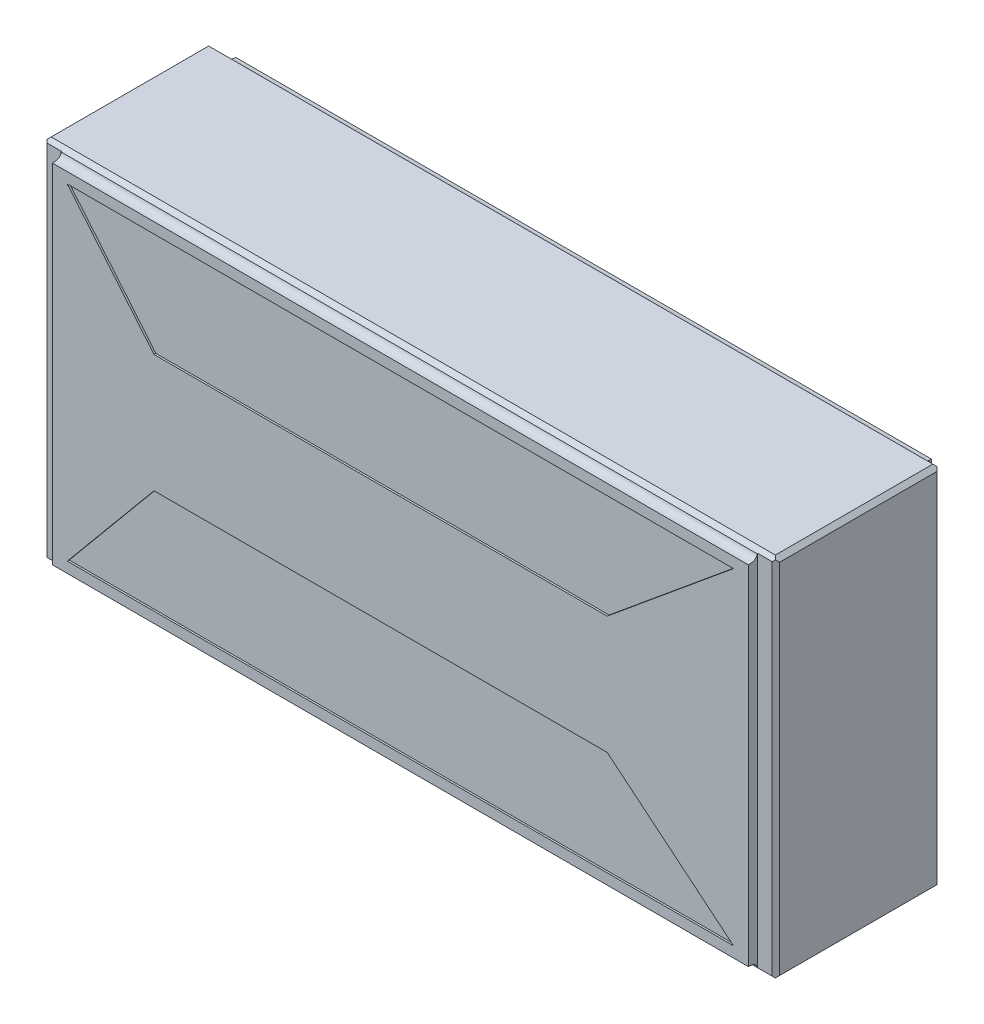
from build123d import *

# Parameters (mm, degrees)
BOSS_EXTRUDE3_DEPTH      = 45
BOSS_EXTRUDE3_DEPTH_BACK = 45
SKETCH4_W                = 400
SKETCH4_H                = 200
BOSS_EXTRUDE9_DEPTH      = 50
BOSS_EXTRUDE9_DEPTH_BACK = 50
EXTRUDE_THIN1_START      = -380
EXTRUDE_THIN1_DEPTH      = 380
MIRROR6_START            = -380
MIRROR6_COPY_1_DEPTH     = 380
CUT_EXTRUDE5_DEPTH       = 243.950612345
MIRROR8_COPY_1_DEPTH     = 243.950612345
CUT_EXTRUDE6_DEPTH       = 1
CHAMFER2_SIZE            = 2
CHAMFER3_START           = -200
CHAMFER3_DEPTH           = 400
MIRROR11_COPY_1_DEPTH    = 1


with BuildPart() as part:
    # Sketch4 → Boss-Extrude3 (new, two sides: drawn at the far end of the back side and taken through both)
    with BuildSketch(Plane.XY.offset(-BOSS_EXTRUDE3_DEPTH_BACK)):
        Rectangle(SKETCH4_W, SKETCH4_H)
    extrude(amount=BOSS_EXTRUDE3_DEPTH + BOSS_EXTRUDE3_DEPTH_BACK)

    # Sketch5 → Boss-Extrude9 (add, two sides: drawn at the far end of the back side and taken through both)
    with BuildSketch(Plane.XY.offset(-BOSS_EXTRUDE9_DEPTH_BACK)):
        with BuildLine():
            ThreePointArc((2.236067977, -1.118033989), (0, -0.590169944), (-2.236067977, -1.118033989))
            Line((-2.236067977, -1.118033989), (-190, -95))
            Line((-190, -95), (-190, 95))
            Line((-190, 95), (-2.236067977, 1.118033989))
            ThreePointArc((-2.236067977, 1.118033989), (0, 0.590169944), (2.236067977, 1.118033989))
            Line((2.236067977, 1.118033989), (190, 95))
            Line((190, 95), (190, -95))
            Line((190, -95), (2.236067977, -1.118033989))
        make_face()
        with BuildLine():
            ThreePointArc((2.236067977, 1.118033989), (0, 0.590169944), (-2.236067977, 1.118033989))
            Line((-2.236067977, 1.118033989), (-190, 95))
            Line((-190, 95), (190, 95))
            Line((190, 95), (2.236067977, 1.118033989))
        make_face()
        with BuildLine():
            Line((2.236067977, -1.118033989), (190, -95))
            Line((190, -95), (-190, -95))
            Line((-190, -95), (-2.236067977, -1.118033989))
            ThreePointArc((-2.236067977, -1.118033989), (0, -0.590169944), (2.236067977, -1.118033989))
        make_face()
    extrude(amount=BOSS_EXTRUDE9_DEPTH + BOSS_EXTRUDE9_DEPTH_BACK)

    # Extrude-Thin1: read off the stored shape, not the designer's step
    # Extrude-Thin1 outline → Extrude-Thin1 (add)
    with BuildSketch(Plane.ZY.offset(190).offset(EXTRUDE_THIN1_START)):
        with BuildLine():
            add(Edge.make_bspline(
                [(-50, 95), (-48.146158838, 95), (-45.468843049, 95.640067172), (-45, 98.16553813), (-45, 100)],
                knots=[0, 0, 0, 0, 0.512954667, 1, 1, 1, 1], degree=3))
            Line((-50, 95), (-45, 95))
            Line((-45, 95), (-45, 100))
        make_face()
    extrude_thin1 = extrude(amount=EXTRUDE_THIN1_DEPTH)

    # Mirror5: Extrude-Thin1 across plane
    add(extrude_thin1.mirror(Plane.ZX))

    # Mirror6: Extrude-Thin1 across plane
    add(extrude_thin1.mirror(Plane.XY))

    # Mirror6 copy 1 sketch → Mirror6 copy 1 (add)
    with BuildSketch(Plane(origin=(-190, 0, 0), x_dir=(0, 0, -1), z_dir=(-1, 0, 0)).offset(MIRROR6_START)):
        with BuildLine():
            add(Edge.make_bspline(
                [(-50, 95), (-48.146158838, 95), (-45.468843049, 95.640067172), (-45, 98.16553813), (-45, 100)],
                knots=[0, 0, 0, 0, 0.512954667, 1, 1, 1, 1], degree=3))
            Line((-50, 95), (-45, 95))
            Line((-45, 95), (-45, 100))
        make_face()
    extrude(amount=MIRROR6_COPY_1_DEPTH)

    # Sketch11 → Cut-Extrude5 (cut, through all)
    with BuildSketch(Plane(origin=(0, 0, -45), x_dir=(-1, 0, 0), z_dir=(0, 0, -1))):
        Polygon((-197.710907072, 100), (-200, 97.710907072), (-200, 100), align=None)
    cut_extrude5 = extrude(amount=-CUT_EXTRUDE5_DEPTH, mode=Mode.SUBTRACT)

    # Mirror7: Cut-Extrude5 across plane
    add(cut_extrude5.mirror(Plane.ZX), mode=Mode.SUBTRACT)

    # Mirror8: Cut-Extrude5 across plane
    add(cut_extrude5.mirror(Plane(origin=(0, 0, 0), x_dir=(0, 0, 1), z_dir=(1, 0, 0))), mode=Mode.SUBTRACT)

    # Mirror8 copy 1 sketch → Mirror8 copy 1 (cut, through all)
    with BuildSketch(Plane(origin=(0, 0, -45), x_dir=(1, 0, 0), z_dir=(0, 0, -1))):
        Polygon((-197.710907072, 100), (-200, 97.710907072), (-200, 100), align=None)
    extrude(amount=-MIRROR8_COPY_1_DEPTH, mode=Mode.SUBTRACT)

    # Sketch12 → Cut-Extrude6 (cut)
    with BuildSketch(Plane(origin=(0, 0, -50), x_dir=(-1, 0, 0), z_dir=(0, 0, -1))):
        Polygon((-181.874897075, 89.170531546), (181.874897075, 89.170531546), (134.560480933, 32.233127844), (-112.917374812, 32.233127844), align=None)
    cut_extrude6 = extrude(amount=-CUT_EXTRUDE6_DEPTH, mode=Mode.SUBTRACT)

    # Mirror9: Cut-Extrude6 across plane
    add(cut_extrude6.mirror(Plane.ZX), mode=Mode.SUBTRACT)

    # Chamfer2
    chamfer2_edges = [part.edges().sort_by_distance(p)[0] for p in [
        (200, 0, 45),
        (200, 0, -45),
        (-200, 0, -45),
        (-200, 0, 45),
    ]]
    chamfer(chamfer2_edges, length=CHAMFER2_SIZE)

    # Chamfer3: read off the stored shape, not the designer's step
    # Chamfer3 outline → Chamfer3 (cut)
    with BuildSketch(Plane.YZ.offset(CHAMFER3_START)):
        with BuildLine():
            Line((-100, 45), (-100, 43))
            Line((-100, 43), (-97.823486796, 45.176513202))
            add(Edge.make_bspline(
                [(-97.823486796, 45.176513202), (-98.429622739, 45.049035026), (-99.14991283, 45), (-100, 45)],
                knots=[0.774303846, 0.774303846, 0.774303846, 0.774303846, 1, 1, 1, 1], degree=3))
        make_face()
        with BuildLine():
            Line((-100, -43), (-100, -45))
            add(Edge.make_bspline(
                [(-97.823486796, -45.176513202), (-98.429622739, -45.049035026), (-99.14991283, -45), (-100, -45)],
                knots=[0.774303846, 0.774303846, 0.774303846, 0.774303846, 1, 1, 1, 1], degree=3))
            Line((-97.823486796, -45.176513202), (-100, -43))
        make_face()
        with BuildLine():
            Line((100, 43), (100, 45))
            add(Edge.make_bspline(
                [(97.823486796, 45.176513202), (98.429622739, 45.049035026), (99.14991283, 45), (100, 45)],
                knots=[0.774303846, 0.774303846, 0.774303846, 0.774303846, 1, 1, 1, 1], degree=3))
            Line((97.823486796, 45.176513202), (100, 43))
        make_face()
        with BuildLine():
            add(Edge.make_bspline(
                [(97.823486796, -45.176513202), (98.429622739, -45.049035026), (99.14991283, -45), (100, -45)],
                knots=[0.774303846, 0.774303846, 0.774303846, 0.774303846, 1, 1, 1, 1], degree=3))
            Line((100, -45), (100, -43))
            Line((100, -43), (97.823486796, -45.176513202))
        make_face()
    extrude(amount=CHAMFER3_DEPTH, mode=Mode.SUBTRACT)

    # Mirror11: Cut-Extrude6 across plane
    add(cut_extrude6.mirror(Plane.XY), mode=Mode.SUBTRACT)

    # Mirror11 copy 1 sketch → Mirror11 copy 1 (cut)
    with BuildSketch(Plane(origin=(0, 0, 50), x_dir=(-1, 0, 0), z_dir=(0, 0, 1))):
        Polygon((-181.874897075, 89.170531546), (181.874897075, 89.170531546), (134.560480933, 32.233127844), (-112.917374812, 32.233127844), align=None)
    extrude(amount=-MIRROR11_COPY_1_DEPTH, mode=Mode.SUBTRACT)


solid = part.part
